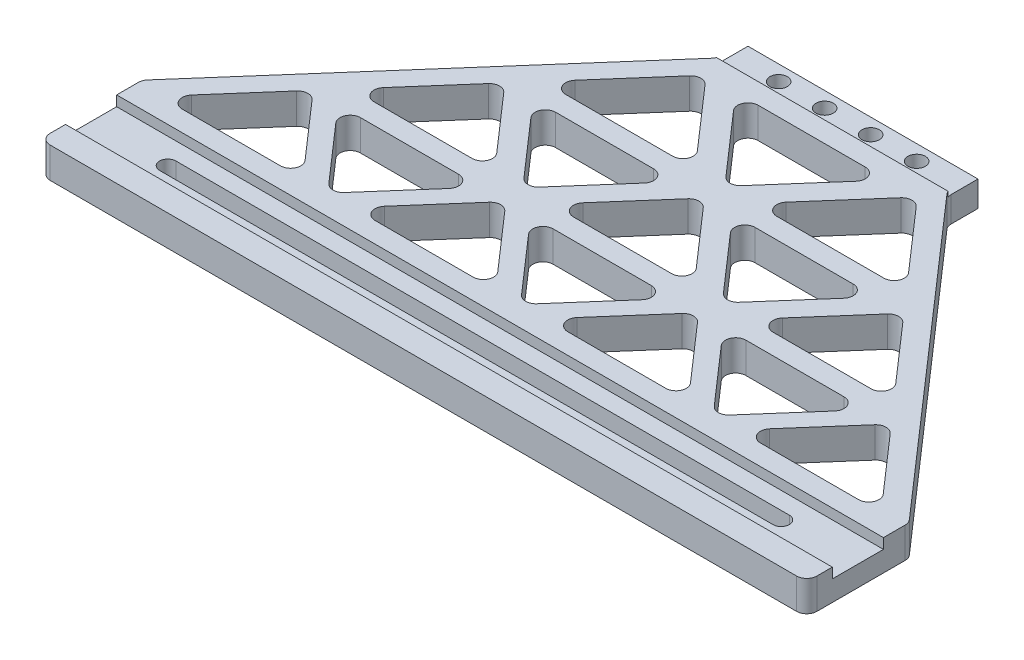
from build123d import *

# Parameters (mm, degrees)
EXTRUDE_1_DEPTH     = 6
SKETCH_2_W          = 150
SKETCH_2_H          = 10
CUT_EXTRUDE_1_DEPTH = 2
FILLET_3_R          = 2
SKETCH_3_W          = 47
SKETCH_3_H          = 6
CUT_EXTRUDE_2_DEPTH = 1
HOLE_WIZARD_M31_D   = 3.4
CUT_EXTRUDE_3_DEPTH = 112.937482552
CUT_EXTRUDE_4_REACH = 114.027
FILLET_1_R          = 2


with BuildPart() as part:
    # Эскиз1 → Бобышка-Вытянуть1 (new body)
    with BuildSketch(Plane(origin=(0, 0, 0), x_dir=(1, 0, 0), z_dir=(0, 1, 0))):
        Polygon((-22.5, 3), (22.5, 3), (22.5, -3), (75, -63), (75, -83), (-75, -83), (-75, -63), (-22.5, -3), align=None)
    extrude(amount=EXTRUDE_1_DEPTH)

    # Эскиз2 → Вырез-Вытянуть1 (cut)
    with BuildSketch(Plane(origin=(0, 6, 0), x_dir=(1, 0, 0), z_dir=(0, 1, 0))):
        with Locations((0, -73)):
            Rectangle(SKETCH_2_W, SKETCH_2_H)
    extrude(amount=-CUT_EXTRUDE_1_DEPTH, mode=Mode.SUBTRACT)

    # Скругление3
    fillet_3_edges = [part.edges().sort_by_distance(p)[0] for p in [
        (22.5, 3, 3),
        (-22.5, 3, 3),
    ]]
    fillet(fillet_3_edges, radius=FILLET_3_R)

    # Эскиз3 → Вырез-Вытянуть2 (cut)
    with BuildSketch(Plane(origin=(0, 6, 0), x_dir=(1, 0, 0), z_dir=(0, 1, 0))):
        Rectangle(SKETCH_3_W, SKETCH_3_H)
    extrude(amount=-CUT_EXTRUDE_2_DEPTH, mode=Mode.SUBTRACT)

    # Отверстие с зазором M31 (through all)
    with Locations(Plane(origin=(0, 0, 0), x_dir=(-1, 0, 0), z_dir=(0, -1, 0))):
        with Locations((-13.5, 0), (-4.5, 0), (4.5, 0), (13.5, 0)):
            Hole(HOLE_WIZARD_M31_D / 2)

    # Эскиз9 → Вырез-Вытянуть3 (cut, through all)
    with BuildSketch(Plane(origin=(0, 4, 0), x_dir=(1, 0, 0), z_dir=(0, 1, 0))):
        with BuildLine():
            Line((-60, -71.4), (60, -71.4))
            ThreePointArc((60, -71.4), (61.6, -73), (60, -74.6))
            Line((60, -74.6), (-60, -74.6))
            ThreePointArc((-60, -74.6), (-61.6, -73), (-60, -71.4))
        make_face()
    extrude(amount=-CUT_EXTRUDE_3_DEPTH, mode=Mode.SUBTRACT)

    # Эскиз10 → Вырез-Вытянуть4 (cut, up to next)
    with BuildSketch(Plane(origin=(0, 6, 0), x_dir=(1, 0, 0), z_dir=(0, 1, 0)), mode=Mode.PRIVATE) as cut_extrude_4_sk1:
        Polygon((-70.559927094, -64), (-56.559927094, -48), (-42.559927094, -64), align=None)
    cut_extrude_4_tool1 = extrude(cut_extrude_4_sk1.sketch, amount=-CUT_EXTRUDE_4_REACH, mode=Mode.PRIVATE) & part.part
    # Эскиз10 → Вырез-Вытянуть4 (cut, up to next)
    with BuildSketch(Plane(origin=(0, 6, 0), x_dir=(1, 0, 0), z_dir=(0, 1, 0)), mode=Mode.PRIVATE) as cut_extrude_4_sk2:
        Polygon((-51.709923067, -48), (-37.709923067, -64), (-23.709923067, -48), align=None)
    cut_extrude_4_tool2 = extrude(cut_extrude_4_sk2.sketch, amount=-CUT_EXTRUDE_4_REACH, mode=Mode.PRIVATE) & part.part
    # Эскиз10 → Вырез-Вытянуть4 (cut, up to next)
    with BuildSketch(Plane(origin=(0, 6, 0), x_dir=(1, 0, 0), z_dir=(0, 1, 0)), mode=Mode.PRIVATE) as cut_extrude_4_sk3:
        Polygon((-18.85991904, -48), (-32.85991904, -64), (-4.85991904, -64), align=None)
    cut_extrude_4_tool3 = extrude(cut_extrude_4_sk3.sketch, amount=-CUT_EXTRUDE_4_REACH, mode=Mode.PRIVATE) & part.part
    # Эскиз10 → Вырез-Вытянуть4 (cut, up to next)
    with BuildSketch(Plane(origin=(0, 6, 0), x_dir=(1, 0, 0), z_dir=(0, 1, 0)), mode=Mode.PRIVATE) as cut_extrude_4_sk4:
        Polygon((-14.009915012, -48), (-0.009915012, -64), (13.990084988, -48), align=None)
    cut_extrude_4_tool4 = extrude(cut_extrude_4_sk4.sketch, amount=-CUT_EXTRUDE_4_REACH, mode=Mode.PRIVATE) & part.part
    # Эскиз10 → Вырез-Вытянуть4 (cut, up to next)
    with BuildSketch(Plane(origin=(0, 6, 0), x_dir=(1, 0, 0), z_dir=(0, 1, 0)), mode=Mode.PRIVATE) as cut_extrude_4_sk5:
        Polygon((18.840089015, -48), (4.840089015, -64), (32.840089015, -64), align=None)
    cut_extrude_4_tool5 = extrude(cut_extrude_4_sk5.sketch, amount=-CUT_EXTRUDE_4_REACH, mode=Mode.PRIVATE) & part.part
    # Эскиз10 → Вырез-Вытянуть4 (cut, up to next)
    with BuildSketch(Plane(origin=(0, 6, 0), x_dir=(1, 0, 0), z_dir=(0, 1, 0)), mode=Mode.PRIVATE) as cut_extrude_4_sk6:
        Polygon((23.690093042, -48), (37.690093042, -64), (51.690093042, -48), align=None)
    cut_extrude_4_tool6 = extrude(cut_extrude_4_sk6.sketch, amount=-CUT_EXTRUDE_4_REACH, mode=Mode.PRIVATE) & part.part
    # Эскиз10 → Вырез-Вытянуть4 (cut, up to next)
    with BuildSketch(Plane(origin=(0, 6, 0), x_dir=(1, 0, 0), z_dir=(0, 1, 0)), mode=Mode.PRIVATE) as cut_extrude_4_sk7:
        Polygon((42.540097069, -64), (70.540097069, -64), (56.540097069, -48), align=None)
    cut_extrude_4_tool7 = extrude(cut_extrude_4_sk7.sketch, amount=-CUT_EXTRUDE_4_REACH, mode=Mode.PRIVATE) & part.part
    # Эскиз10 → Вырез-Вытянуть4 (cut, up to next)
    with BuildSketch(Plane(origin=(0, 6, 0), x_dir=(1, 0, 0), z_dir=(0, 1, 0)), mode=Mode.PRIVATE) as cut_extrude_4_sk8:
        Polygon((-53.059927094, -44), (-39.059927094, -28), (-25.059927094, -44), align=None)
    cut_extrude_4_tool8 = extrude(cut_extrude_4_sk8.sketch, amount=-CUT_EXTRUDE_4_REACH, mode=Mode.PRIVATE) & part.part
    # Эскиз10 → Вырез-Вытянуть4 (cut, up to next)
    with BuildSketch(Plane(origin=(0, 6, 0), x_dir=(1, 0, 0), z_dir=(0, 1, 0)), mode=Mode.PRIVATE) as cut_extrude_4_sk9:
        Polygon((-33.545538953, -28), (-19.545538953, -44), (-5.545538953, -28), align=None)
    cut_extrude_4_tool9 = extrude(cut_extrude_4_sk9.sketch, amount=-CUT_EXTRUDE_4_REACH, mode=Mode.PRIVATE) & part.part
    # Эскиз10 → Вырез-Вытянуть4 (cut, up to next)
    with BuildSketch(Plane(origin=(0, 6, 0), x_dir=(1, 0, 0), z_dir=(0, 1, 0)), mode=Mode.PRIVATE) as cut_extrude_4_sk10:
        Polygon((-0.031150813, -28), (-14.031150813, -44), (13.968849187, -44), align=None)
    cut_extrude_4_tool10 = extrude(cut_extrude_4_sk10.sketch, amount=-CUT_EXTRUDE_4_REACH, mode=Mode.PRIVATE) & part.part
    # Эскиз10 → Вырез-Вытянуть4 (cut, up to next)
    with BuildSketch(Plane(origin=(0, 6, 0), x_dir=(1, 0, 0), z_dir=(0, 1, 0)), mode=Mode.PRIVATE) as cut_extrude_4_sk11:
        Polygon((5.483237327, -28), (19.483237327, -44), (33.483237327, -28), align=None)
    cut_extrude_4_tool11 = extrude(cut_extrude_4_sk11.sketch, amount=-CUT_EXTRUDE_4_REACH, mode=Mode.PRIVATE) & part.part
    # Эскиз10 → Вырез-Вытянуть4 (cut, up to next)
    with BuildSketch(Plane(origin=(0, 6, 0), x_dir=(1, 0, 0), z_dir=(0, 1, 0)), mode=Mode.PRIVATE) as cut_extrude_4_sk12:
        Polygon((24.997625468, -44), (38.997625468, -28), (52.997625468, -44), align=None)
    cut_extrude_4_tool12 = extrude(cut_extrude_4_sk12.sketch, amount=-CUT_EXTRUDE_4_REACH, mode=Mode.PRIVATE) & part.part
    # Эскиз10 → Вырез-Вытянуть4 (cut, up to next)
    with BuildSketch(Plane(origin=(0, 6, 0), x_dir=(1, 0, 0), z_dir=(0, 1, 0)), mode=Mode.PRIVATE) as cut_extrude_4_sk13:
        Polygon((-35.559927094, -24), (-20.684927094, -7), (-5.809927094, -24), align=None)
    cut_extrude_4_tool13 = extrude(cut_extrude_4_sk13.sketch, amount=-CUT_EXTRUDE_4_REACH, mode=Mode.PRIVATE) & part.part
    # Эскиз10 → Вырез-Вытянуть4 (cut, up to next)
    with BuildSketch(Plane(origin=(0, 6, 0), x_dir=(1, 0, 0), z_dir=(0, 1, 0)), mode=Mode.PRIVATE) as cut_extrude_4_sk14:
        Polygon((-14.904785308, -7), (-0.029785308, -24), (14.845214692, -7), align=None)
    cut_extrude_4_tool14 = extrude(cut_extrude_4_sk14.sketch, amount=-CUT_EXTRUDE_4_REACH, mode=Mode.PRIVATE) & part.part
    # Эскиз10 → Вырез-Вытянуть4 (cut, up to next)
    with BuildSketch(Plane(origin=(0, 6, 0), x_dir=(1, 0, 0), z_dir=(0, 1, 0)), mode=Mode.PRIVATE) as cut_extrude_4_sk15:
        Polygon((20.625356478, -7), (5.750356478, -24), (35.500356478, -24), align=None)
    cut_extrude_4_tool15 = extrude(cut_extrude_4_sk15.sketch, amount=-CUT_EXTRUDE_4_REACH, mode=Mode.PRIVATE) & part.part
    add(cut_extrude_4_tool1.solids().sort_by_distance((-56.559927, 6, 58.666667))[0], mode=Mode.SUBTRACT)
    add(cut_extrude_4_tool2.solids().sort_by_distance((-37.709923, 6, 53.333333))[0], mode=Mode.SUBTRACT)
    add(cut_extrude_4_tool3.solids().sort_by_distance((-18.859919, 6, 58.666667))[0], mode=Mode.SUBTRACT)
    add(cut_extrude_4_tool4.solids().sort_by_distance((-0.009915, 6, 53.333333))[0], mode=Mode.SUBTRACT)
    add(cut_extrude_4_tool5.solids().sort_by_distance((18.840089, 6, 58.666667))[0], mode=Mode.SUBTRACT)
    add(cut_extrude_4_tool6.solids().sort_by_distance((37.690093, 6, 53.333333))[0], mode=Mode.SUBTRACT)
    add(cut_extrude_4_tool7.solids().sort_by_distance((56.540097, 6, 58.666667))[0], mode=Mode.SUBTRACT)
    add(cut_extrude_4_tool8.solids().sort_by_distance((-39.059927, 6, 38.666667))[0], mode=Mode.SUBTRACT)
    add(cut_extrude_4_tool9.solids().sort_by_distance((-19.545539, 6, 33.333333))[0], mode=Mode.SUBTRACT)
    add(cut_extrude_4_tool10.solids().sort_by_distance((-0.031151, 6, 38.666667))[0], mode=Mode.SUBTRACT)
    add(cut_extrude_4_tool11.solids().sort_by_distance((19.483237, 6, 33.333333))[0], mode=Mode.SUBTRACT)
    add(cut_extrude_4_tool12.solids().sort_by_distance((38.997625, 6, 38.666667))[0], mode=Mode.SUBTRACT)
    add(cut_extrude_4_tool13.solids().sort_by_distance((-20.684927, 6, 18.333333))[0], mode=Mode.SUBTRACT)
    add(cut_extrude_4_tool14.solids().sort_by_distance((-0.029785, 6, 12.666667))[0], mode=Mode.SUBTRACT)
    add(cut_extrude_4_tool15.solids().sort_by_distance((20.625356, 6, 18.333333))[0], mode=Mode.SUBTRACT)

    # Скругление1
    fillet_1_edges = [part.edges().sort_by_distance(p)[0] for p in [
        (18.840089015, 3, 48),
        (23.690093042, 3, 48),
        (-14.009915012, 3, 48),
        (-51.709923067, 3, 48),
        (-33.545538953, 3, 28),
        (5.483237327, 3, 28),
        (5.750356478, 3, 24),
        (24.997625468, 3, 44),
        (4.840089015, 3, 64),
        (-32.85991904, 3, 64),
        (-70.559927094, 3, 64),
        (-14.031150813, 3, 44),
        (-53.059927094, 3, 44),
        (-35.559927094, 3, 24),
        (-42.559927094, 3, 64),
        (-25.059927094, 3, 44),
        (-4.85991904, 3, 64),
        (35.500356478, 3, 24),
        (52.997625468, 3, 44),
        (70.540097069, 3, 64),
        (32.840089015, 3, 64),
        (13.968849187, 3, 44),
        (-5.809927094, 3, 24),
        (-0.029785308, 3, 24),
        (-37.709923067, 3, 64),
        (-0.009915012, 3, 64),
        (19.483237327, 3, 44),
        (37.690093042, 3, 64),
        (56.540097069, 3, 48),
        (38.997625468, 3, 28),
        (-0.031150813, 3, 28),
        (-18.85991904, 3, 48),
        (-56.559927094, 3, 48),
        (-39.059927094, 3, 28),
        (-20.684927094, 3, 7),
        (20.625356478, 3, 7),
        (-23.709923067, 3, 48),
        (13.990084988, 3, 48),
        (-5.545538953, 3, 28),
        (51.690093042, 3, 48),
        (33.483237327, 3, 28),
        (14.845214692, 3, 7),
        (-75, 3, 63),
        (-75, 3, 83),
        (75, 3, 83),
        (75, 3, 63),
        (-19.545538953, 3, 44),
        (42.540097069, 3, 64),
        (-14.904785308, 3, 7),
    ]]
    fillet(fillet_1_edges, radius=FILLET_1_R)


solid = part.part
